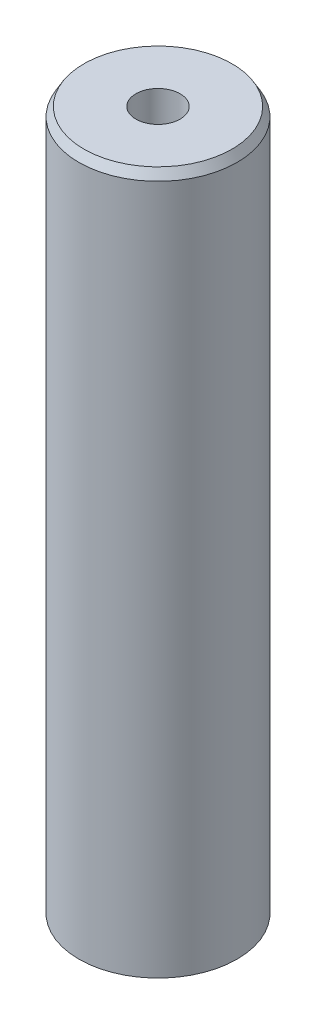
from build123d import *
from OCP.BRepFilletAPI import BRepFilletAPI_MakeChamfer

# Parameters (mm, degrees)
SKETCH1_R           = 12.5
BOSS_EXTRUDE1_DEPTH = 111.164300151
SKETCH2_R           = 3.485117678
CUT_EXTRUDE1_DEPTH  = 113.561101754
CHAMFER1_SIZE       = 1.40490392
CHAMFER1_SIZE2      = 0.811121656


with BuildPart() as part:
    # Sketch1 → Boss-Extrude1 (new body)
    with BuildSketch(Plane(origin=(0, 0, 0), x_dir=(1, 0, 0), z_dir=(0, 1, 0))):
        Circle(SKETCH1_R)
    extrude(amount=BOSS_EXTRUDE1_DEPTH)

    # Sketch2 → Cut-Extrude1 (cut, through all)
    with BuildSketch(Plane(origin=(0, 0, 0), x_dir=(1, 0, 0), z_dir=(0, 1, 0))):
        Circle(SKETCH2_R)
    extrude(amount=CUT_EXTRUDE1_DEPTH, mode=Mode.SUBTRACT)

    # Chamfer1: one chamfer whose edges measure the first distance from different faces: ONE call of the kernel's chamfer builder (chamfer() names one face for all edges)
    chamfer1_edges_1 = [part.edges().sort_by_distance(p)[0] for p in [
        (-12.5, 111.164300151, 0),
    ]]
    chamfer1_side_1 = [part.faces().sort_by_distance(p)[0] for p in [
        (-12.5, 55.582150076, 0),
    ]]
    chamfer1_edges_2 = [part.edges().sort_by_distance(p)[0] for p in [
        (-12.5, 0, 0),
    ]]
    chamfer1_side_2 = [part.faces().sort_by_distance(p)[0] for p in [
        (-12.146446609, 0, 0),
    ]]
    chamfer1 = BRepFilletAPI_MakeChamfer(part.part.solid().wrapped)
    for e in chamfer1_edges_1:
        chamfer1.Add(CHAMFER1_SIZE, CHAMFER1_SIZE2, e.wrapped, chamfer1_side_1[0].wrapped)  # the first distance lies on this face
    for e in chamfer1_edges_2:
        chamfer1.Add(CHAMFER1_SIZE, CHAMFER1_SIZE2, e.wrapped, chamfer1_side_2[0].wrapped)  # the first distance lies on this face
    add(Compound.cast(chamfer1.Shape()), mode=Mode.REPLACE)


solid = part.part
